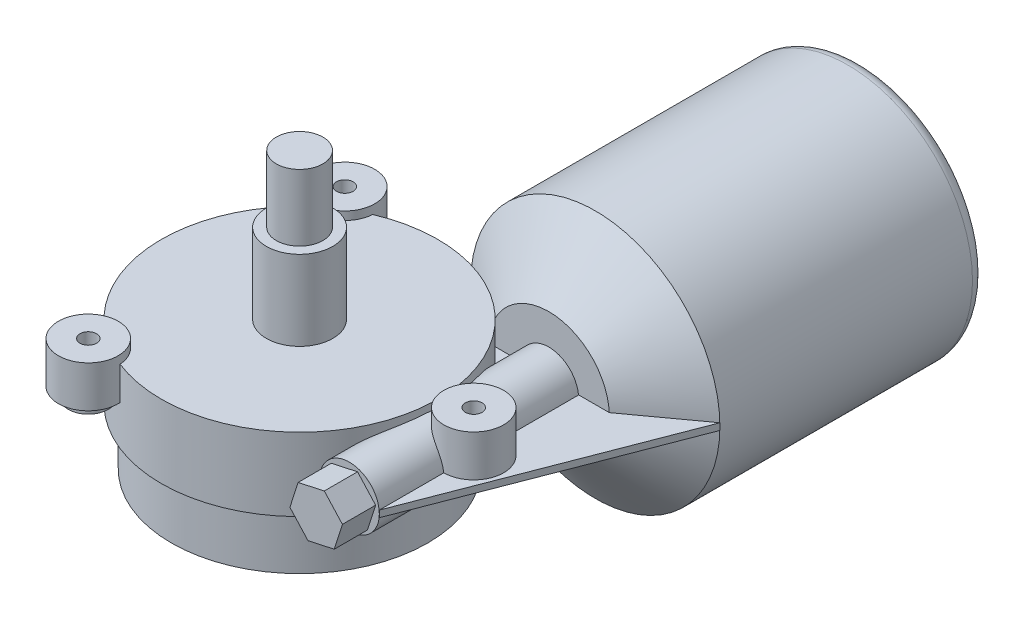
from build123d import *

# Parameters (mm, degrees)
SKETCH_1_R               = 37.5
EXTRUDE_1_DEPTH          = 80
SKETCH_2_R               = 19
EXTRUDE_2_DEPTH          = 10
SKETCH_3_R               = 9.5
EXTRUDE_3_DEPTH          = 6
EXTRUDE_3_TAPER          = 19
FILLET_1_R               = 2
FILLET_2_R               = 4
FILLET_3_R               = 4
SKETCH_5_R               = 37.5
EXTRUDE_4_DEPTH          = 14
EXTRUDE_4_TAPER          = 54
SKETCH_6_R               = 9
EXTRUDE_5_DEPTH          = 60
EXTRUDE_START            = -1
EXTRUDE_9_DEPTH          = 2
EXTRUDE_9_2_DEPTH        = 2
EXTRUDE_START_2          = -11
SKETCH_8_R               = 41.626315452
EXTRUDE_12_DEPTH         = 22
EXTRUDE_13_DEPTH         = 10
SKETCH_11_R              = 38.599997009
SKETCH_11_R_2            = 36.599997009
EXTRUDE_1_2_DEPTH        = 17
SKETCH_12_R              = 38.006343928
EXTRUDE_14_DEPTH         = 1
FILLET_4_R               = 4
SKETCH_14_R              = 10
EXTRUDE_15_DEPTH         = 24
SKETCH_27_R              = 7
EXTRUDE_19_DEPTH         = 20
EXTRUDE_23_OUTLINE_R     = 9
EXTRUDE_23_OUTLINE_R_2   = 2.5
EXTRUDE_23_DEPTH         = 12.5
EXTRUDE_23_2_OUTLINE_R   = 9
EXTRUDE_23_2_OUTLINE_R_2 = 2.5
EXTRUDE_23_2_DEPTH       = 12.5
SKETCH_40_R              = 6
EXTRUDE_24_DEPTH         = 3


# Read off the part's stored shape, not the designer's step: Вытянуть23
with BuildPart() as part:
    # Эскиз1 → Extrude 1 (new body)
    with BuildSketch(Plane.XY):
        Circle(SKETCH_1_R)
    extrude(amount=EXTRUDE_1_DEPTH)

    # Эскиз2 → Вытянуть2 (add)
    with BuildSketch(Plane(origin=(0, 0, 0), x_dir=(-1, 0, 0), z_dir=(0, 0, -1))):
        with Locations(Location((0, 0, 0), (0, 0, 180))):
            Circle(SKETCH_2_R)
    extrude(amount=EXTRUDE_2_DEPTH)

    # Эскиз3 → Вытянуть3 (add)
    with BuildSketch(Plane(origin=(0, 0, -10), x_dir=(-1, 0, 0), z_dir=(0, 0, -1))):
        Circle(SKETCH_3_R)
    extrude(amount=EXTRUDE_3_DEPTH, taper=EXTRUDE_3_TAPER)

    # Скругление1
    fillet_1_edges = [part.edges().sort_by_distance(p)[0] for p in [
        (7.43403432, 0, -16),
    ]]
    fillet(fillet_1_edges, radius=FILLET_1_R)

    # Скругление2
    fillet_2_edges = [part.edges().sort_by_distance(p)[0] for p in [
        (-19, 0, -10),
    ]]
    fillet(fillet_2_edges, radius=FILLET_2_R)

    # Скругление3
    fillet_3_edges = [part.edges().sort_by_distance(p)[0] for p in [
        (-37.5, 0, 0),
    ]]
    fillet(fillet_3_edges, radius=FILLET_3_R)

    # Эскиз5 → Вытянуть4 (add)
    with BuildSketch(Plane.XY.offset(80)):
        Circle(SKETCH_5_R)
    extrude(amount=EXTRUDE_4_DEPTH, taper=EXTRUDE_4_TAPER)

    # Эскиз6 → Вытянуть5 (add)
    with BuildSketch(Plane.XY.offset(94)):
        Circle(SKETCH_6_R)
    extrude(amount=EXTRUDE_5_DEPTH)



with BuildPart() as body_2:
    # Эскиз7 → Вытянуть9 (new body)
    with BuildSketch(Plane(origin=(0, 0, 0), x_dir=(1, 0, 0), z_dir=(0, 1, 0)).offset(EXTRUDE_START)):
        Polygon((37.5, -80), (9, -154), (9, -94), (18.230653113, -94), align=None)
    extrude(amount=EXTRUDE_9_DEPTH)

    # Вытянуть23 outline → Вытянуть23 (add)
    with BuildSketch(Plane(origin=(0, 1, 0), x_dir=(1, 0, 0), z_dir=(0, 1, 0))):
        with Locations((9, -125.582440014)):
            Circle(EXTRUDE_23_OUTLINE_R)
        with Locations((9, -125.582440014)):
            Circle(EXTRUDE_23_OUTLINE_R_2, mode=Mode.SUBTRACT)
    extrude(amount=EXTRUDE_23_DEPTH)


with BuildPart() as body_3:
    # Эскиз7 → Extrude 9 2 (new body)
    with BuildSketch(Plane(origin=(0, 0, 0), x_dir=(1, 0, 0), z_dir=(0, 1, 0)).offset(EXTRUDE_START)):
        Polygon((-32.625954593, -83.541201272), (-18.230653113, -94), (-9, -94), (-9, -115.425880537), (-22.152005265, -94), (-38.1951407, -91.206528342), align=None)
    extrude(amount=EXTRUDE_9_2_DEPTH)


with BuildPart() as body_4:
    # Эскиз8 → Вытянуть12 (new body)
    with BuildSketch(Plane(origin=(0, 0, 0), x_dir=(1, 0, 0), z_dir=(0, 1, 0)).offset(EXTRUDE_START_2)):
        with Locations(Location((-42.711575953, -126.274756618, 0), (0, 0, 270))):
            Circle(SKETCH_8_R)
    extrude(amount=EXTRUDE_12_DEPTH)


with BuildPart() as part_1:
    add(part.part)

    add(body_4.part)  # Вытянуть13 merges body 4
    # Эскиз9 → Вытянуть13 (add)
    with BuildSketch(Plane.XY.offset(154)):
        Polygon((-2.449124643, -7.702929431), (5.446370249, -5.972468873), (7.895494892, 1.730460558), (2.449124643, 7.702929431), (-5.446370249, 5.972468873), (-7.895494892, -1.730460558), align=None)
    extrude(amount=EXTRUDE_13_DEPTH)

    # Эскиз11 → Extrude 1 2 (add)
    with BuildSketch(Plane.XZ.offset(11)):
        with Locations((-42.711575953, 126.274756618)):
            Circle(SKETCH_11_R)
        with Locations((-42.711575953, 126.274756618)):
            Circle(SKETCH_11_R_2, mode=Mode.SUBTRACT)
    extrude(amount=EXTRUDE_1_2_DEPTH)

    # Эскиз12 → Вытянуть14 (add)
    with BuildSketch(Plane.XZ.offset(28)):
        with Locations(Location((-42.711575953, 126.274756618, 0), (0, 0, 270))):
            Circle(SKETCH_12_R)
    extrude(amount=EXTRUDE_14_DEPTH)

    # Скругление4
    # the kernel refuses this fillet: 4 mm, written as the material it takes off along each edge
    with BuildSketch(Plane(origin=(-42.711575953, -29, 126.274756618), x_dir=(0, 0, -1), z_dir=(-1, 0, 0))) as fillet_4_piece_1:
        with BuildLine():
            CenterArc((35.360592617, -4), FILLET_4_R, 48.590377891, 41.409622109)
            Line((35.360592617, 0), (35.360592617, 0.08))
            Line((35.360592617, 0.08), (38.006343928, 0.08))
            Line((38.006343928, 0.08), (38.086343928, 0))
            ThreePointArc((38.086343928, 0), (38.086343928, -0.5), (38.059258954, -0.94))
            Line((38.059258954, -0.94), (38.006343928, -1))
        make_face()
    revolve(axis=Axis((-42.711575953, -29, 126.274756618), (0, -1, 0)), mode=Mode.SUBTRACT)

    # Эскиз14 → Вытянуть15 (add)
    with BuildSketch(Plane(origin=(0, 11, 0), x_dir=(1, 0, 0), z_dir=(0, 1, 0))):
        with Locations(Location((-42.711575953, -126.274756618, 0), (0, 0, 270))):
            Circle(SKETCH_14_R)
    extrude(amount=EXTRUDE_15_DEPTH)

    # Эскиз27 → Вытянуть19 (add)
    with BuildSketch(Plane(origin=(0, 35, 0), x_dir=(1, 0, 0), z_dir=(0, 1, 0))):
        with Locations(Location((-42.711575953, -126.274756618, 0), (0, 0, 270))):
            Circle(SKETCH_27_R)
    extrude(amount=EXTRUDE_19_DEPTH)

    # Extrude 23 2 outline → Extrude 23 2 (add)
    # profile 1 of 2: a face of its own
    with BuildSketch(Plane(origin=(0, 1, 0), x_dir=(1, 0, 0), z_dir=(0, 1, 0))):
        with Locations((-68, -87.378825206)):
            Circle(EXTRUDE_23_2_OUTLINE_R)
        with Locations((-68, -87.378825206)):
            Circle(EXTRUDE_23_2_OUTLINE_R_2, mode=Mode.SUBTRACT)
    # profile 2 of 2: a face of its own
    with BuildSketch(Plane(origin=(0, 1, 0), x_dir=(1, 0, 0), z_dir=(0, 1, 0))):
        with Locations((-67, -165.568890181)):
            Circle(EXTRUDE_23_2_OUTLINE_R)
        with Locations((-67, -165.568890181)):
            Circle(EXTRUDE_23_2_OUTLINE_R_2, mode=Mode.SUBTRACT)
    extrude(amount=EXTRUDE_23_2_DEPTH)

    # Эскиз40 → Вытянуть24 (add)
    with BuildSketch(Plane.XZ.offset(-1)):
        with Locations((-68, 87.378825206)):
            Circle(SKETCH_40_R)
        with Locations((-67, 165.568890181)):
            Circle(SKETCH_40_R)
    extrude(amount=EXTRUDE_24_DEPTH)


solid = Compound([body_2.part, body_3.part, part_1.part])
